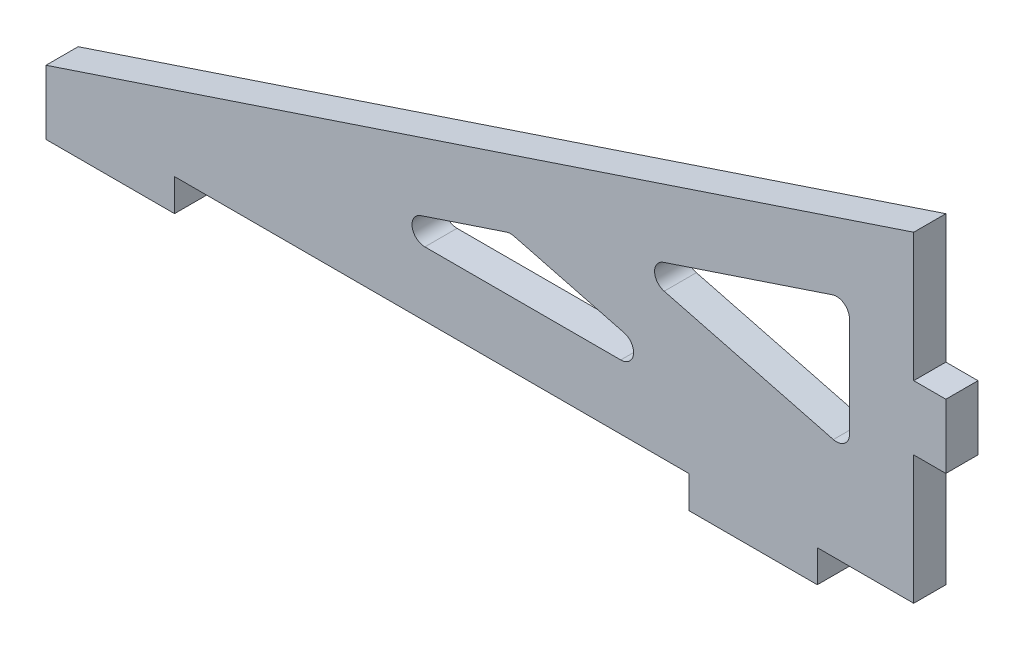
from build123d import *

# Parameters (mm, degrees)
BOSS_EXTRUDE1_DEPTH = 6.35
CUT_EXTRUDE1_DEPTH  = 226.594808564
FILLET1_R           = 2.54


with BuildPart() as part:
    # Sketch2 → Boss-Extrude1 (new body)
    with BuildSketch(Plane.XY):
        Polygon((-92.950015109, 148.30800019), (78.499984891, 205.45800019), (78.499984891, 180.05800019), (84.849984891, 180.05800019), (84.849984891, 167.35800019), (78.499984891, 167.35800019), (78.499984891, 141.95800019), (59.449984891, 141.95800019), (59.449984891, 135.60800019), (34.049984891, 135.60800019), (34.049984891, 141.95800019), (-67.550015109, 141.95800019), (-67.550015109, 135.60800019), (-92.950015109, 135.60800019), (-92.950015109, 141.95800019), align=None)
    extrude(amount=BOSS_EXTRUDE1_DEPTH)

    # Sketch3 → Cut-Extrude1 (cut, through all)
    with BuildSketch(Plane.XY.offset(6.35)):
        Polygon((-1.239180443, 165.491302984), (-33.739088825, 154.65800019), (40.515121465, 154.65800019), align=None)
        Polygon((65.799984891, 187.837691429), (20.894399366, 172.869162921), (65.799984891, 161.218248334), align=None)
    extrude(amount=-CUT_EXTRUDE1_DEPTH, mode=Mode.SUBTRACT)

    # Fillet1
    fillet1_edges = [part.edges().sort_by_distance(p)[0] for p in [
        (65.799984891, 187.837691429, 3.175),
        (20.894399366, 172.869162921, 3.175),
        (-1.239180443, 165.491302984, 3.175),
        (40.515121465, 154.65800019, 3.175),
        (-33.739088825, 154.65800019, 3.175),
        (65.799984891, 161.218248334, 3.175),
    ]]
    fillet(fillet1_edges, radius=FILLET1_R)


solid = part.part
